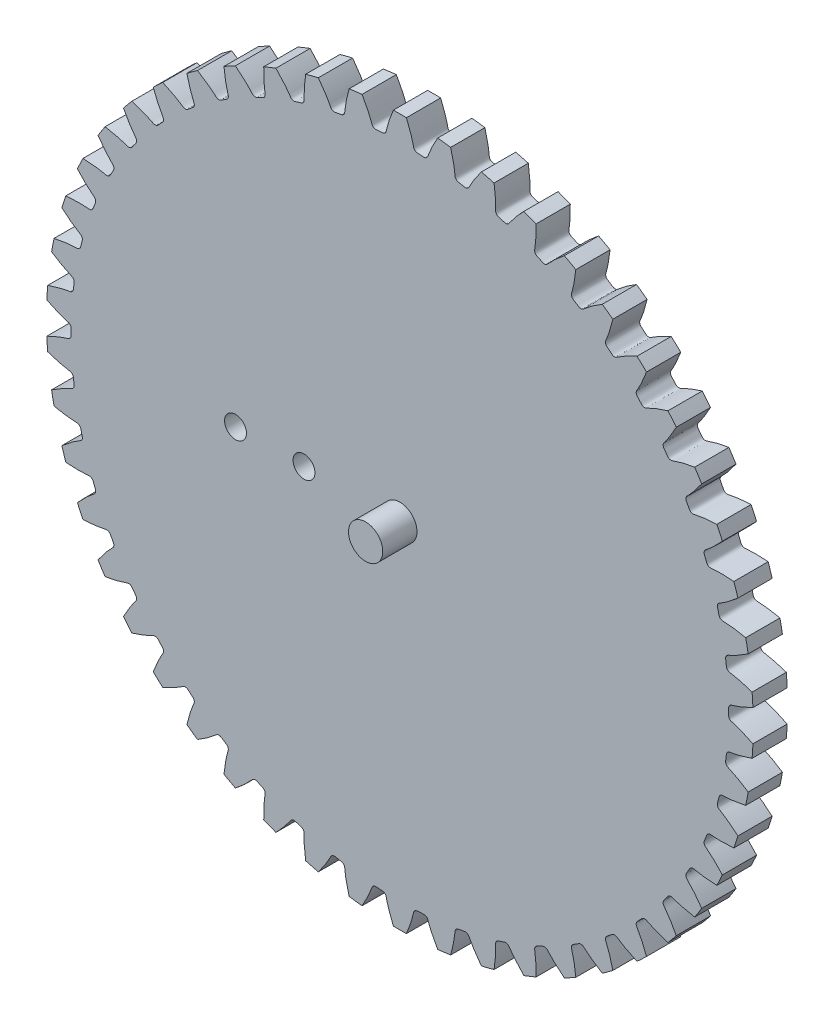
from build123d import *

# Parameters (mm, degrees)
SKETCHREVOLVESPURGEAR2_W       = 20
SKETCHREVOLVESPURGEAR2_H       = 51.599999225
TOOTHEXTRUDECUTSPURGEAR2_DEPTH = 10
PATTERNSPURGEAR2_COUNT         = 50
BOREREVOLVESKETCH_W            = 20
BOREREVOLVESKETCH_H            = 5
CUT_EXTRUDE_START              = -15
SKETCH_5_R                     = 51.599999225
CUT_EXTRUDE_2_DEPTH            = 15
SKETCH_6_R                     = 5
EXTRUDE_1_DEPTH                = 5
SKETCH_7_R                     = 1.6
CUT_EXTRUDE_6_DEPTH            = 5
SKETCH_8_R                     = 2.5
EXTRUDE_2_DEPTH                = 5


with BuildPart() as part:
    # SketchRevolveSpurGear2 → SpurGear2 (revolve)
    with BuildSketch(Plane(origin=(0, 0, 0), x_dir=(0, 0, -1), z_dir=(1, 0, 0))):
        with Locations((0, 25.799999613)):
            Rectangle(SKETCHREVOLVESPURGEAR2_W, SKETCHREVOLVESPURGEAR2_H)
    revolve(axis=Axis((0, 0, 0), (0, 0, -1)))

    # SketchToothSpurGear2 → ToothExtrudeCutSpurGear2 (cut, symmetric)
    with BuildSketch(Plane.XY):
        with BuildLine():
            ThreePointArc((51.627584331, 2.326984297), (51.679999224, 0), (51.627584331, -2.326984297))
            add(Edge.make_bspline(
                [(51.627584331, -2.326984297), (51.436682923, -2.228906073), (51.183189992, -2.103412608), (50.86689012, -1.95506305), (50.685305342, -1.872171969), (50.507448345, -1.793189847), (50.333380009, -1.718030737), (50.163159798, -1.646607818), (49.996845807, -1.578833427), (49.834494689, -1.514619239), (49.676161819, -1.453875667), (49.521900674, -1.396514102), (49.371765008, -1.342439016), (49.225801048, -1.291576176), (49.084075219, -1.243772384), (48.946575631, -1.19915164), (48.727008038, -1.129328105), (48.519673852, -1.075272971), (48.331572493, -1.006412181), (48.248817241, -0.956321077), (48.174766606, -0.894430965), (48.111664956, -0.821297733), (48.060974916, -0.739076933), (48.02428924, -0.649806354), (48.001545692, -0.555798765), (47.994977037, -0.414855045), (48.000898342, -0.229782248), (47.999549753, 0), (48.000898342, 0.229782248), (47.994977037, 0.414855045), (48.001545692, 0.555798765), (48.02428924, 0.649806354), (48.060974916, 0.739076933), (48.111664956, 0.821297733), (48.174766606, 0.894430965), (48.248817241, 0.956321077), (48.331572493, 1.006412181), (48.519673852, 1.075272971), (48.727008038, 1.129328105), (48.946575631, 1.19915164), (49.084075219, 1.243772384), (49.225801048, 1.291576176), (49.371765008, 1.342439016), (49.521900674, 1.396514102), (49.676161819, 1.453875667), (49.834494689, 1.514619239), (49.996845807, 1.578833427), (50.163159798, 1.646607818), (50.333380009, 1.718030737), (50.507448345, 1.793189847), (50.685305342, 1.872171969), (50.86689012, 1.95506305), (51.183189992, 2.103412608), (51.436682923, 2.228906073), (51.627584331, 2.326984297)],
                knots=[0, 0, 0, 0, 0.068658041, 0.090477037, 0.11176242, 0.132514192, 0.152732352, 0.1724169, 0.191567836, 0.210185161, 0.228268873, 0.245818974, 0.262835463, 0.27931834, 0.295267605, 0.310683258, 0.325565299, 0.368965254, 0.379219699, 0.389474144, 0.399728589, 0.409983033, 0.420237478, 0.430491923, 0.440746368, 0.451000813, 0.475500687, 0.5, 0.524499313, 0.548999187, 0.559253632, 0.569508077, 0.579762522, 0.590016967, 0.600271411, 0.610525856, 0.620780301, 0.631034746, 0.674434701, 0.689316742, 0.704732395, 0.72068166, 0.737164537, 0.754181026, 0.771731127, 0.789814839, 0.808432164, 0.8275831, 0.847267648, 0.867485808, 0.88823758, 0.909522963, 0.931341959, 1, 1, 1, 1], degree=3))
        make_face()
    toothextrudecutspurgear2 = extrude(amount=TOOTHEXTRUDECUTSPURGEAR2_DEPTH, both=True, mode=Mode.SUBTRACT)

    # PatternSpurGear2: ToothExtrudeCutSpurGear2 ×50 about axis
    patternspurgear2_axis = Axis((0, 0, 55), (0, 0, -1))
    for i in range(1, PATTERNSPURGEAR2_COUNT):
        add(toothextrudecutspurgear2.rotate(patternspurgear2_axis, i * 360 / PATTERNSPURGEAR2_COUNT), mode=Mode.SUBTRACT)

    # BoreRevolveSketch → BoreRevolveCut (revolve, cut)
    with BuildSketch(Plane(origin=(0, 0, 0), x_dir=(0, 0, -1), z_dir=(1, 0, 0))):
        with Locations((0, 2.5)):
            Rectangle(BOREREVOLVESKETCH_W, BOREREVOLVESKETCH_H)
    revolve(axis=Axis((0, 0, 0), (0, 0, -1)), mode=Mode.SUBTRACT)

    # 草图5 → 切除-拉伸2 (cut)
    with BuildSketch(Plane.XY.offset(10).offset(CUT_EXTRUDE_START)):
        Circle(SKETCH_5_R)
    extrude(amount=CUT_EXTRUDE_2_DEPTH, mode=Mode.SUBTRACT)

    # 草图6 → 凸台-拉伸1 (add)
    with BuildSketch(Plane.XY.offset(-5)):
        Circle(SKETCH_6_R)
    extrude(amount=-EXTRUDE_1_DEPTH)

    # 草图7 → 切除-拉伸6 (cut)
    with BuildSketch(Plane(origin=(0, 0, -10), x_dir=(-1, 0, 0), z_dir=(0, 0, -1))):
        with Locations((13.99999964, 0)):
            Circle(SKETCH_7_R)
        with Locations((23.99999964, 0)):
            Circle(SKETCH_7_R)
    extrude(amount=-CUT_EXTRUDE_6_DEPTH, mode=Mode.SUBTRACT)

    # 草图8 → 凸台-拉伸2 (add)
    with BuildSketch(Plane.XY.offset(-5)):
        Circle(SKETCH_8_R)
    extrude(amount=EXTRUDE_2_DEPTH)


solid = part.part
